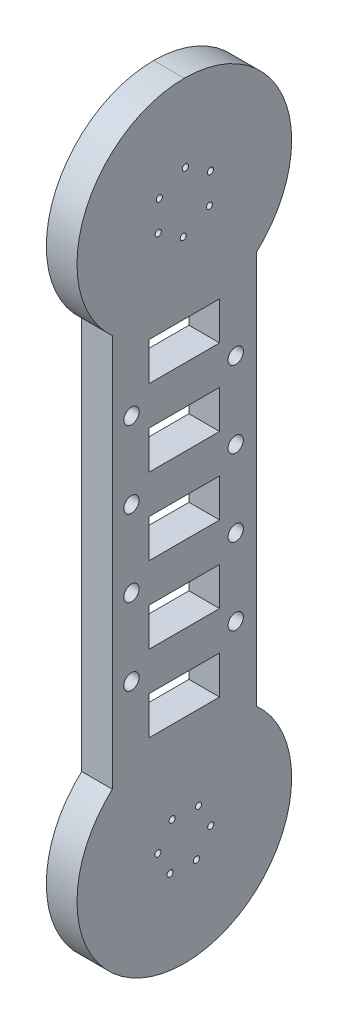
from build123d import *

# Parameters (mm, degrees)
SKETCH_2_W               = 140
SKETCH_2_H               = 140
EXTRUDE_1_DEPTH          = 500
FILLET_1_R               = 70
FILLET_2_R               = 70
SKETCH_5_W               = 100
SKETCH_5_H               = 141.285409295
CUT_EXTRUDE_2_DEPTH      = 300
CUT_EXTRUDE_START        = -20
SKETCH_6_R               = 80
CUT_EXTRUDE_3_DEPTH      = 100
SKETCH_8_W               = 100
SKETCH_8_H               = 420
CUT_EXTRUDE_4_DEPTH      = 188
CUT_EXTRUDE_6_DEPTH      = 185
SKETCH_10_W              = 46
SKETCH_10_H              = 24.912851684
CUT_EXTRUDE_7_DEPTH      = 185
CUT_EXTRUDE_9_DEPTH      = 192
CUT_EXTRUDE_9_DEPTH_BACK = 192
SKETCH_12_W              = 70.971879984
SKETCH_12_H              = 535.265340004
SKETCH_13_R              = 5
CUT_EXTRUDE_10_DEPTH     = 192
SKETCH_15_R              = 29.5
CUT_EXTRUDE_11_DEPTH     = 10
SKETCH_17_R              = 2
CUT_EXTRUDE_12_DEPTH     = 10
SKETCH_18_R              = 29.5
CUT_EXTRUDE_14_DEPTH     = 10
SKETCH_20_R              = 2
CUT_EXTRUDE_15_DEPTH     = 10


with BuildPart() as part:
    # 草图2 → 凸台-拉伸1 (new body)
    with BuildSketch(Plane(origin=(0, 0, 0), x_dir=(1, 0, 0), z_dir=(0, 1, 0))):
        Rectangle(SKETCH_2_W, SKETCH_2_H)
    extrude(amount=EXTRUDE_1_DEPTH)

    # 圆角1
    fillet_1_edges = [part.edges().sort_by_distance(p)[0] for p in [
        (0, 500, -70),
        (0, 500, 70),
    ]]
    fillet(fillet_1_edges, radius=FILLET_1_R - 0.0001)  # a hair under: the kernel refuses the full size

    # 圆角2
    fillet_2_edges = [part.edges().sort_by_distance(p)[0] for p in [
        (0, 0, 70),
        (0, 0, -70),
    ]]
    fillet(fillet_2_edges, radius=FILLET_2_R - 0.0001)  # a hair under: the kernel refuses the full size

    # 草图5 → 切除-拉伸2 (cut)
    with BuildSketch(Plane.XY.offset(70)):
        with Locations((0, 430.642704648)):
            Rectangle(SKETCH_5_W, SKETCH_5_H)
    extrude(amount=-CUT_EXTRUDE_2_DEPTH, mode=Mode.SUBTRACT)

    # 草图6 → 切除-拉伸3 (cut)
    with BuildSketch(Plane(origin=(70, 0, 0), x_dir=(0, 0, -1), z_dir=(1, 0, 0)).offset(CUT_EXTRUDE_START)):
        with Locations((0, 430)):
            Circle(SKETCH_6_R)
        with Locations((0, 70)):
            Circle(SKETCH_6_R)
    extrude(amount=-CUT_EXTRUDE_3_DEPTH, mode=Mode.SUBTRACT)

    # 草图8 → 切除-拉伸4 (cut)
    with BuildSketch(Plane.XY.offset(70)):
        with Locations((0, 210)):
            Rectangle(SKETCH_8_W, SKETCH_8_H)
    extrude(amount=-CUT_EXTRUDE_4_DEPTH, mode=Mode.SUBTRACT)


with BuildPart() as cut_extrude_4_piece_1:
    # of the separate pieces the step leaves, piece 1, a body of its own (cut_extrude_4_pieces)
    add(part.part.solids().sort_by_distance((-70, 69.9999, 70))[0])


with BuildPart() as cut_extrude_4_piece_2:
    # of the separate pieces the step leaves, piece 2, a body of its own (cut_extrude_4_pieces)
    add(part.part.solids().sort_by_distance((50, 69.9999, 70))[0])


with BuildPart() as cut_extrude_6_tool:
    # 草图9 → 切除-拉伸6 (new body)
    with BuildSketch(Plane.ZY.offset(70)):
        with BuildLine():
            Line((-70, 430), (-70, 70))
            ThreePointArc((-70, 70), (-63.981049548, 98.3976284), (-46.959277178, 121.911716278))
            Line((-46.959277178, 121.911716278), (-46.959277178, 378.088283722))
            ThreePointArc((-46.959277178, 378.088283722), (-63.981049548, 401.6023716), (-70, 430))
        make_face()
        with BuildLine():
            Line((46.959277178, 378.088283722), (46.959277178, 121.911716278))
            ThreePointArc((46.959277178, 121.911716278), (63.981049548, 98.3976284), (70, 70))
            Line((70, 70), (70, 430))
            ThreePointArc((70, 430), (63.981049548, 401.6023716), (46.959277178, 378.088283722))
        make_face()
    extrude(amount=-CUT_EXTRUDE_6_DEPTH)


with BuildPart() as cut_extrude_4_piece_1_1:
    add(cut_extrude_4_piece_1.part)

    # 切除-拉伸6: cut by cut_extrude_6_tool
    add(cut_extrude_6_tool.part, mode=Mode.SUBTRACT)


with BuildPart() as cut_extrude_4_piece_2_1:
    add(cut_extrude_4_piece_2.part)

    # 切除-拉伸6: cut by cut_extrude_6_tool
    add(cut_extrude_6_tool.part, mode=Mode.SUBTRACT)


with BuildPart() as cut_extrude_7_tool:
    # 草图10 → 切除-拉伸7 (new body)
    with BuildSketch(Plane(origin=(70, 0, 0), x_dir=(0, 0, -1), z_dir=(1, 0, 0))):
        with Locations((0, 301.446288317)):
            Rectangle(SKETCH_10_W, SKETCH_10_H)
        with Locations((0, 351.446288317)):
            Rectangle(SKETCH_10_W, SKETCH_10_H)
        with Locations((0, 251.446288317)):
            Rectangle(SKETCH_10_W, SKETCH_10_H)
        with Locations((0, 201.446288317)):
            Rectangle(SKETCH_10_W, SKETCH_10_H)
        with Locations((0, 151.446288317)):
            Rectangle(SKETCH_10_W, SKETCH_10_H)
    extrude(amount=-CUT_EXTRUDE_7_DEPTH)


with BuildPart() as cut_extrude_4_piece_1_2:
    add(cut_extrude_4_piece_1_1.part)

    # 切除-拉伸7: cut by cut_extrude_7_tool
    add(cut_extrude_7_tool.part, mode=Mode.SUBTRACT)

    # 草图13 → 切除-拉伸10 (cut)
    with BuildSketch(Plane.ZY.offset(70)):
        with Locations((-33.507435555, 326.527789487)):
            Circle(SKETCH_13_R)
        with Locations((34.492564445, 326.527789487)):
            Circle(SKETCH_13_R)
        with Locations((-33.507435555, 276.527789487)):
            Circle(SKETCH_13_R)
        with Locations((-33.507435555, 226.527789487)):
            Circle(SKETCH_13_R)
        with Locations((-33.507435555, 176.527789487)):
            Circle(SKETCH_13_R)
        with Locations((34.492564445, 276.527789487)):
            Circle(SKETCH_13_R)
        with Locations((34.492564445, 226.527789487)):
            Circle(SKETCH_13_R)
        with Locations((34.492564445, 176.527789487)):
            Circle(SKETCH_13_R)
    extrude(amount=-CUT_EXTRUDE_10_DEPTH, mode=Mode.SUBTRACT)

    # 草图15 → 切除-拉伸11 (cut)
    with BuildSketch(Plane.ZY.offset(70)):
        with Locations((0, 70)):
            Circle(SKETCH_15_R)
    extrude(amount=-CUT_EXTRUDE_11_DEPTH, mode=Mode.SUBTRACT)

    # 草图17 → 切除-拉伸12 (cut)
    with BuildSketch(Plane.ZY.offset(60)):
        with Locations((-9.287970724, 84.53602765)):
            Circle(SKETCH_17_R)
        with Locations((7.944583853, 85.311632421)):
            Circle(SKETCH_17_R)
        with Locations((17.232554577, 70.775604771)):
            Circle(SKETCH_17_R)
        with Locations((9.287970724, 55.46397235)):
            Circle(SKETCH_17_R)
        with Locations((-7.944583853, 54.688367579)):
            Circle(SKETCH_17_R)
        with Locations((-17.232554577, 69.224395229)):
            Circle(SKETCH_17_R)
    extrude(amount=-CUT_EXTRUDE_12_DEPTH, mode=Mode.SUBTRACT)

    # 草图18 → 切除-拉伸14 (cut)
    with BuildSketch(Plane.ZY.offset(70)):
        with Locations((0, 430)):
            Circle(SKETCH_18_R)
    extrude(amount=-CUT_EXTRUDE_14_DEPTH, mode=Mode.SUBTRACT)

    # 草图20 → 切除-拉伸15 (cut)
    with BuildSketch(Plane.ZY.offset(60)):
        with Locations((-0.697918411, 449.237344149)):
            Circle(SKETCH_20_R)
        with Locations((16.311069529, 440.223087148)):
            Circle(SKETCH_20_R)
        with Locations((17.00898794, 420.985742999)):
            Circle(SKETCH_20_R)
        with Locations((0.697918411, 410.762655851)):
            Circle(SKETCH_20_R)
        with Locations((-16.311069529, 419.776912852)):
            Circle(SKETCH_20_R)
        with Locations((-17.00898794, 439.014257001)):
            Circle(SKETCH_20_R)
    extrude(amount=-CUT_EXTRUDE_15_DEPTH, mode=Mode.SUBTRACT)


with BuildPart() as cut_extrude_4_piece_2_2:
    add(cut_extrude_4_piece_2_1.part)

    # 切除-拉伸7: cut by cut_extrude_7_tool
    add(cut_extrude_7_tool.part, mode=Mode.SUBTRACT)

    # 草图12 → 切除-拉伸9 (cut, two sides: drawn at the far end of the back side and taken through both)
    with BuildSketch(Plane(origin=(0, 0, -46.959277178), x_dir=(-1, 0, 0), z_dir=(0, 0, -1)).offset(-CUT_EXTRUDE_9_DEPTH_BACK)):
        with Locations((-52.025627734, 250)):
            Rectangle(SKETCH_12_W, SKETCH_12_H)
    extrude(amount=CUT_EXTRUDE_9_DEPTH + CUT_EXTRUDE_9_DEPTH_BACK, mode=Mode.SUBTRACT)


solid = cut_extrude_4_piece_1_2.part
